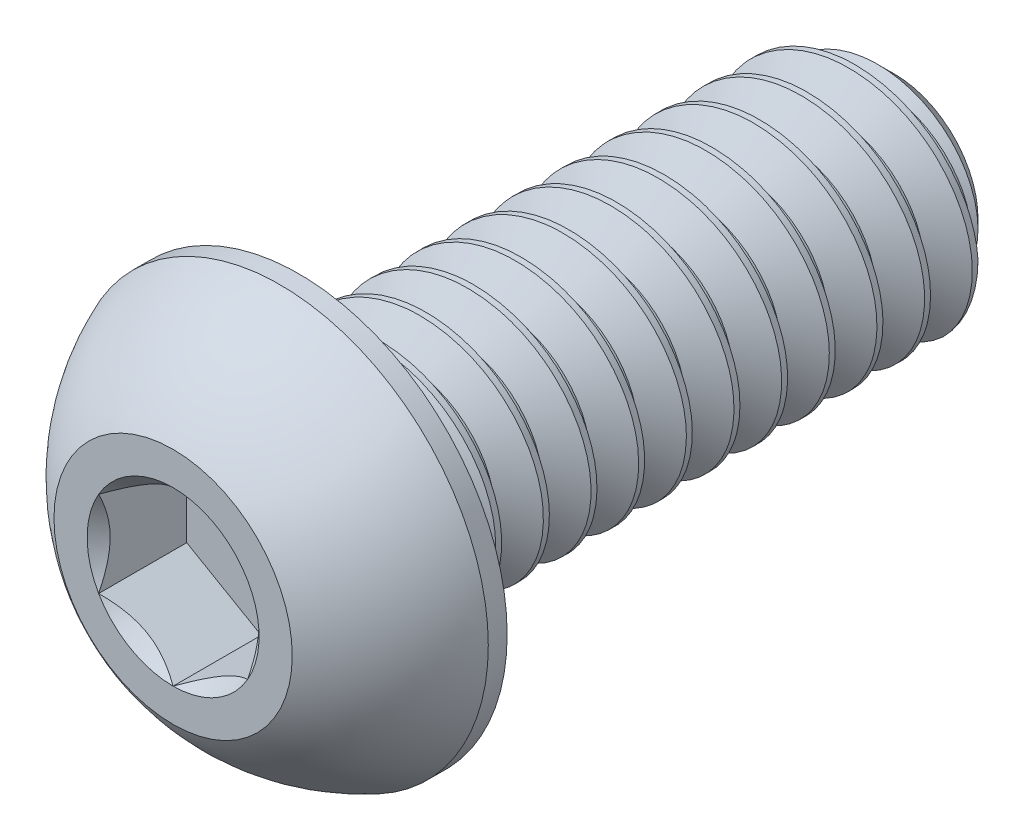
from build123d import *

# Parameters (mm, degrees)
SKETCH1_W          = 15.875
SKETCH1_H          = 3.175
CHAMFER1_SIZE      = 0.9525
CUT_SWEEP1_PITCH   = 1.27
CUT_EXTRUDE2_DEPTH = 2.34696


with BuildPart() as part:
    # Sketch1 → Revolve1 (revolve)
    with BuildSketch(Plane(origin=(0, 0, 0), x_dir=(0, 0, -1), z_dir=(1, 0, 0))):
        with Locations((11.2903, 1.5875)):
            Rectangle(SKETCH1_W, SKETCH1_H)
    revolve(axis=Axis((0, 0, -19.2278), (0, 0, 1)))

    # Chamfer1
    chamfer1_edges = [part.edges().sort_by_distance(p)[0] for p in [
        (0, -3.175, -19.2278),
    ]]
    chamfer(chamfer1_edges, length=CHAMFER1_SIZE)

    # Cut-Sweep1: the profile of Sketch2 profile screwed along a right-hand helix of 13.5 turns, 8 arcs to a turn; built about Z, then put on its axis
    cut_sweep1_z = Axis((0, 0, 0), (0, 0, 1))
    cut_sweep1_corners = [(3.1753, 0, 0.000173205), (3.1753, 0, -1.111423205), (2.350110803, 0, -0.635), (2.350110803, 0, -0.47625)]
    with BuildLine(mode=Mode.PRIVATE) as cut_sweep1_profile:
        Line(cut_sweep1_corners[0], cut_sweep1_corners[1])
        Line(cut_sweep1_corners[1], cut_sweep1_corners[2])
        Line(cut_sweep1_corners[2], cut_sweep1_corners[3])
        Line(cut_sweep1_corners[3], cut_sweep1_corners[0])
    cut_sweep1_cap = Face(cut_sweep1_profile.wire())
    cut_sweep1_turn_angles = [0, 22.5, 45, 67.5, 90, 112.5, 135, 157.5, 180, 202.5, 225, 247.5, 270, 292.5, 315, 337.5, 360]
    cut_sweep1_turn_weights = [1, 0.9238795325112867, 1, 0.9238795325112867, 1, 0.9238795325112867, 1, 0.9238795325112867, 1, 0.9238795325112867, 1, 0.9238795325112867, 1, 0.9238795325112867, 1, 0.9238795325112867, 1]
    cut_sweep1_turn_rails = [Edge.make_bspline([Vector(p[0], p[1], 0).rotate(cut_sweep1_z, cut_sweep1_turn_angles[k]) / cut_sweep1_turn_weights[k] + Vector(0, 0, p[2] + CUT_SWEEP1_PITCH * cut_sweep1_turn_angles[k] / 360) for k in range(17)], [0, 0, 0, 1, 1, 2, 2, 3, 3, 4, 4, 5, 5, 6, 6, 7, 7, 8, 8, 8], 2, cut_sweep1_turn_weights) for p in cut_sweep1_corners]
    cut_sweep1_turn_sides = [Face.make_surface_from_curves(cut_sweep1_turn_rails[p[0]], cut_sweep1_turn_rails[p[1]]) for p in [(0, 1), (1, 2), (2, 3), (3, 0)]]
    cut_sweep1_last_angles = [4680, 4702.5, 4725, 4747.5, 4770, 4792.5, 4815, 4837.5, 4860]
    cut_sweep1_last_weights = [1, 0.9238795325112867, 1, 0.9238795325112867, 1, 0.9238795325112867, 1, 0.9238795325112655, 1]
    cut_sweep1_last_rails = [Edge.make_bspline([Vector(p[0], p[1], 0).rotate(cut_sweep1_z, cut_sweep1_last_angles[k]) / cut_sweep1_last_weights[k] + Vector(0, 0, p[2] + CUT_SWEEP1_PITCH * cut_sweep1_last_angles[k] / 360) for k in range(9)], [0, 0, 0, 1, 1, 2, 2, 3, 3, 4, 4, 4], 2, cut_sweep1_last_weights) for p in cut_sweep1_corners]
    cut_sweep1_last_sides = [Face.make_surface_from_curves(cut_sweep1_last_rails[p[0]], cut_sweep1_last_rails[p[1]]) for p in [(0, 1), (1, 2), (2, 3), (3, 0)]]
    cut_sweep1 = Plane(origin=(0, 0, -19.2278), x_dir=(0, 1, 0), z_dir=(0, 0, 1)) * Solid(Shell([*[p.moved(Location((0, 0, CUT_SWEEP1_PITCH * i))) for i in range(13) for p in cut_sweep1_turn_sides], *cut_sweep1_last_sides, cut_sweep1_cap, cut_sweep1_cap.rotate(cut_sweep1_z, 4860).moved(Location((0, 0, CUT_SWEEP1_PITCH * 4860 / 360)))]))
    add(cut_sweep1, mode=Mode.SUBTRACT)

    # Sketch7 → Revolve2 (revolve)
    with BuildSketch(Plane(origin=(0, 0, 0), x_dir=(0, 0, -1), z_dir=(1, 0, 0)), mode=Mode.PRIVATE) as revolve2_sk:
        with BuildLine():
            Line((2.84988, 5.5499), (3.3528, 5.5499))
            Line((3.3528, 5.5499), (3.3528, 0))
            Line((3.3528, 0), (0, 0))
            Line((0, 0), (0, 3.175))
            ThreePointArc((0, 3.175), (1.235921075, 4.58927271), (2.84988, 5.5499))
        make_face()
    revolve(revolve2_sk.sketch.rotate(Axis((0, 0, 0), (0, 0, -1)), 189.052465709), axis=Axis((0, 0, 0), (0, 0, -1)))

    # Sketch5 → Cut-Extrude2 (cut)
    with BuildSketch(Plane.XY):
        Polygon((1.984375, -1.14567944), (1.984375, 1.14567944), (0, 2.291358881), (-1.984375, 1.14567944), (-1.984375, -1.14567944), (0, -2.291358881), align=None)
    extrude(amount=-CUT_EXTRUDE2_DEPTH, mode=Mode.SUBTRACT)

    # Cut-Extrude3 cone 1 section (through the dimple's axis) → Cut-Extrude3 (revolve, cut)
    with BuildSketch(Plane(origin=(0, 0, 0), x_dir=(0, -1, 0), z_dir=(1, 0, 0))):
        Polygon((0, 0), (2.291358881, 0), (0, 2.291358881), align=None)
    revolve(axis=Axis((0, 0, 0), (0, 0, -1)), mode=Mode.SUBTRACT)


solid = part.part
